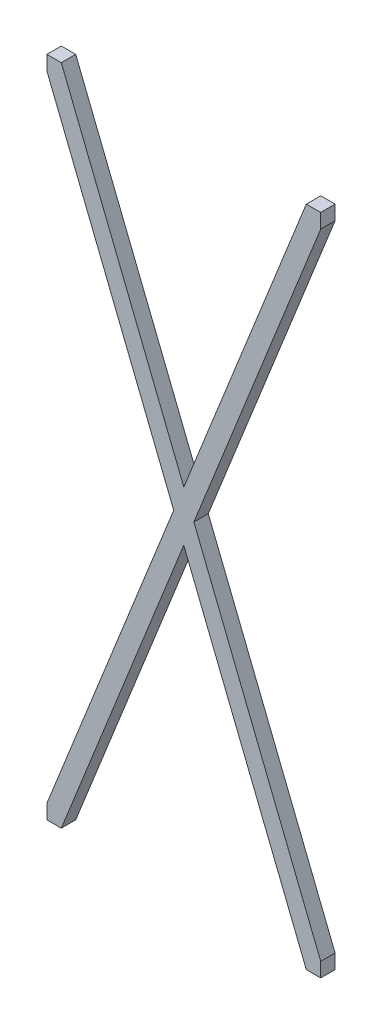
from build123d import *

# Parameters (mm, degrees)
AUFSATZ_LINEAR_AUSTRAGEN1_DEPTH = 50


with BuildPart() as part:
    # Skizze1 → Aufsatz-Linear austragen1 (new body)
    with BuildSketch(Plane.XY):
        Polygon((0, 2300), (50, 2300), (475, 1237.5), (900, 2300), (950, 2300), (950, 2250), (510, 1150), (950, 50), (950, 0), (900, 0), (475, 1062.5), (50, 0), (0, 0), (0, 50), (440, 1150), (0, 2250), align=None)
    extrude(amount=AUFSATZ_LINEAR_AUSTRAGEN1_DEPTH)


solid = part.part
